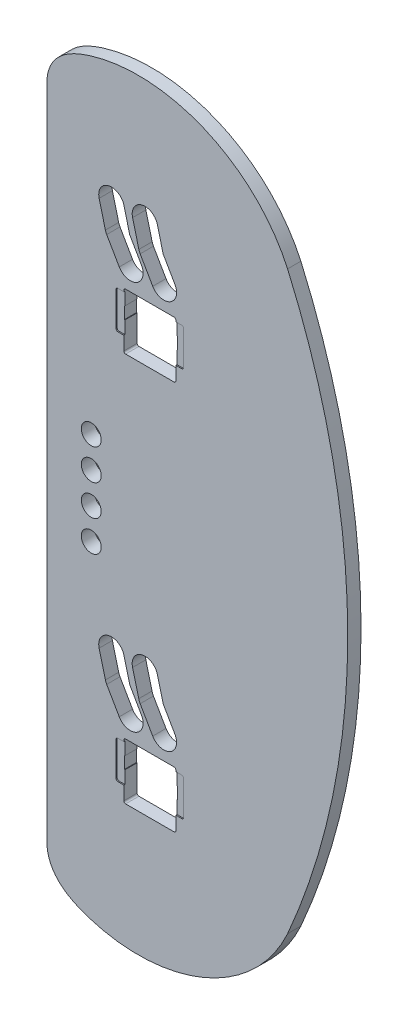
from build123d import *

# Parameters (mm, degrees)
SKETCH19_R          = 14.2875
BOSS_EXTRUDE2_DEPTH = 19.05
BOSS_EXTRUDE3_DEPTH = 17.4625


with BuildPart() as part:
    # Sketch19 → Boss-Extrude2 (new body)
    with BuildSketch(Plane.XY):
        with BuildLine():
            add(Edge.make_bspline(
                [(1361.096561672, 1948.863494174), (1364.400827848, 1984.023171072), (1498.613211066, 2056.462277252), (1658.30760281, 1990.654880293), (1706.236065024, 1885.549246122)],
                knots=[0, 0, 0, 0, 0.219674411, 1, 1, 1, 1], degree=3))
            Line((1361.096561672, 1948.863494174), (1361.096561672, 996.363494176))
            add(Edge.make_bspline(
                [(1361.096561672, 996.363494176), (1364.400827848, 961.203817278), (1498.613211066, 888.764711097), (1658.30760281, 954.572108057), (1706.236065024, 1059.677742228)],
                knots=[0, 0, 0, 0, 0.219674411, 1, 1, 1, 1], degree=3))
            ThreePointArc((1706.236065024, 1059.677742228), (1792.519416012, 1472.613494175), (1706.236065024, 1885.549246122))
        make_face()
        with BuildLine():
            Line((1545.970625126, 1126.827012828), (1545.970625126, 1107.300762828))
            ThreePointArc((1545.970625126, 1107.300762828), (1545.22667635, 1105.504711604), (1543.430625126, 1104.760762828))
            Line((1543.430625126, 1104.760762828), (1473.898125126, 1104.760762828))
            ThreePointArc((1473.898125126, 1104.760762828), (1472.102073902, 1105.504711604), (1471.358125126, 1107.300762828))
            Line((1471.358125126, 1107.300762828), (1471.358125126, 1126.827012828))
            Line((1471.358125126, 1126.827012828), (1462.785625126, 1126.827012828))
            ThreePointArc((1462.785625126, 1126.827012828), (1460.989573902, 1127.570961604), (1460.245625126, 1129.367012828))
            Line((1460.245625126, 1129.367012828), (1460.245625126, 1178.262012828))
            ThreePointArc((1460.245625126, 1178.262012828), (1460.989573902, 1180.058064052), (1462.785625126, 1180.802012828))
            Line((1462.785625126, 1180.802012828), (1471.358125126, 1180.802012828))
            Line((1471.358125126, 1180.802012828), (1471.358125126, 1182.865762828))
            ThreePointArc((1471.358125126, 1182.865762828), (1472.102073902, 1184.661814052), (1473.898125126, 1185.405762828))
            Line((1473.898125126, 1185.405762828), (1543.430625126, 1185.405762828))
            ThreePointArc((1543.430625126, 1185.405762828), (1545.22667635, 1184.661814052), (1545.970625126, 1182.865762828))
            Line((1545.970625126, 1182.865762828), (1545.970625126, 1180.802012828))
            Line((1545.970625126, 1180.802012828), (1554.543125126, 1180.802012828))
            ThreePointArc((1554.543125126, 1180.802012828), (1556.33917635, 1180.058064052), (1557.083125126, 1178.262012828))
            Line((1557.083125126, 1178.262012828), (1557.083125126, 1129.367012828))
            ThreePointArc((1557.083125126, 1129.367012828), (1556.33917635, 1127.570961604), (1554.543125126, 1126.827012828))
            Line((1554.543125126, 1126.827012828), (1545.970625126, 1126.827012828))
        make_face(mode=Mode.SUBTRACT)
        with BuildLine():
            Line((1444.893065071, 1244.244623225), (1435.893057671, 1279.244553225))
            ThreePointArc((1435.893057671, 1279.244553225), (1449.094985702, 1301.58631231), (1471.436744787, 1288.384384279))
            Line((1471.436744787, 1288.384384279), (1479.734522372, 1256.115340295))
            ThreePointArc((1479.734522372, 1256.115340295), (1479.841246759, 1255.791962976), (1479.990269115, 1255.485768066))
            Line((1479.990269115, 1255.485768066), (1495.595800102, 1228.231937145))
            ThreePointArc((1495.595800102, 1228.231937145), (1496.589194493, 1226.682766417), (1497.422422708, 1225.041884612))
            ThreePointArc((1497.422422708, 1225.041884612), (1488.994111708, 1201.213784587), (1464.764130707, 1208.40564094))
            Line((1464.764130707, 1208.40564094), (1446.764069078, 1239.655616711))
            ThreePointArc((1446.764069078, 1239.655616711), (1445.672935755, 1241.886666839), (1444.893065071, 1244.244623225))
        make_face(mode=Mode.SUBTRACT)
        with Locations((1424.596561672, 1405.938494174)):
            Circle(SKETCH19_R, mode=Mode.SUBTRACT)
        with Locations((1424.596561672, 1450.388494174)):
            Circle(SKETCH19_R, mode=Mode.SUBTRACT)
        with BuildLine():
            Line((1527.986726026, 1255.506514787), (1544.56575997, 1226.723451874))
            ThreePointArc((1544.56575997, 1226.723451874), (1537.823790218, 1201.663704337), (1512.764042681, 1208.405674089))
            Line((1512.764042681, 1208.405674089), (1494.764045881, 1239.655687936))
            ThreePointArc((1494.764045881, 1239.655687936), (1493.802589185, 1241.576837352), (1493.072252129, 1243.597189262))
            ThreePointArc((1493.072252129, 1243.597189262), (1492.894588833, 1244.238723731), (1492.740311476, 1244.886280075))
            Line((1492.740311476, 1244.886280075), (1483.894581433, 1279.238653731))
            ThreePointArc((1483.894581433, 1279.238653731), (1497.09201275, 1301.585586702), (1519.436740684, 1288.384422355))
            Line((1519.436740684, 1288.384422355), (1527.727745028, 1256.141718681))
            ThreePointArc((1527.727745028, 1256.141718681), (1527.835693423, 1255.815333734), (1527.986726026, 1255.506514787))
        make_face(mode=Mode.SUBTRACT)
        with Locations((1424.596561672, 1494.838494174)):
            Circle(SKETCH19_R, mode=Mode.SUBTRACT)
        with Locations((1424.596561672, 1539.288494174)):
            Circle(SKETCH19_R, mode=Mode.SUBTRACT)
        with BuildLine():
            Line((1462.785625126, 1739.602012828), (1471.358125126, 1739.602012828))
            Line((1471.358125126, 1739.602012828), (1471.358125126, 1741.665762828))
            ThreePointArc((1471.358125126, 1741.665762828), (1472.102073902, 1743.461814052), (1473.898125126, 1744.205762828))
            Line((1473.898125126, 1744.205762828), (1543.430625126, 1744.205762828))
            ThreePointArc((1543.430625126, 1744.205762828), (1545.22667635, 1743.461814052), (1545.970625126, 1741.665762828))
            Line((1545.970625126, 1741.665762828), (1545.970625126, 1739.602012828))
            Line((1545.970625126, 1739.602012828), (1554.543125126, 1739.602012828))
            ThreePointArc((1554.543125126, 1739.602012828), (1556.33917635, 1738.858064052), (1557.083125126, 1737.062012828))
            Line((1557.083125126, 1737.062012828), (1557.083125126, 1688.167012828))
            ThreePointArc((1557.083125126, 1688.167012828), (1556.33917635, 1686.370961604), (1554.543125126, 1685.627012828))
            Line((1554.543125126, 1685.627012828), (1545.970625126, 1685.627012828))
            Line((1545.970625126, 1685.627012828), (1545.970625126, 1666.100762828))
            ThreePointArc((1545.970625126, 1666.100762828), (1545.22667635, 1664.304711604), (1543.430625126, 1663.560762828))
            Line((1543.430625126, 1663.560762828), (1473.898125126, 1663.560762828))
            ThreePointArc((1473.898125126, 1663.560762828), (1472.102073902, 1664.304711604), (1471.358125126, 1666.100762828))
            Line((1471.358125126, 1666.100762828), (1471.358125126, 1685.627012828))
            Line((1471.358125126, 1685.627012828), (1462.785625126, 1685.627012828))
            ThreePointArc((1462.785625126, 1685.627012828), (1460.989573902, 1686.370961604), (1460.245625126, 1688.167012828))
            Line((1460.245625126, 1688.167012828), (1460.245625126, 1737.062012828))
            ThreePointArc((1460.245625126, 1737.062012828), (1460.989573902, 1738.858064052), (1462.785625126, 1739.602012828))
        make_face(mode=Mode.SUBTRACT)
        with BuildLine():
            Line((1444.893131568, 1803.044661302), (1435.893124168, 1838.044591302))
            ThreePointArc((1435.893124168, 1838.044591302), (1449.095052199, 1860.386350386), (1471.436811284, 1847.184422355))
            Line((1471.436811284, 1847.184422355), (1479.727821657, 1814.941695236))
            ThreePointArc((1479.727821657, 1814.941695236), (1479.835768961, 1814.615312965), (1479.98679977, 1814.30649635))
            Line((1479.98679977, 1814.30649635), (1496.565772911, 1785.52338757))
            ThreePointArc((1496.565772911, 1785.52338757), (1489.823779303, 1760.463721825), (1464.764105889, 1767.205686923))
            Line((1464.764105889, 1767.205686923), (1446.764116481, 1798.455687936))
            ThreePointArc((1446.764116481, 1798.455687936), (1445.672995031, 1800.686722627), (1444.893131568, 1803.044661302))
        make_face(mode=Mode.SUBTRACT)
        with BuildLine():
            Line((1492.893060968, 1803.044661302), (1483.893053568, 1838.044591302))
            ThreePointArc((1483.893053568, 1838.044591302), (1497.094981599, 1860.386350386), (1519.436740684, 1847.184422355))
            Line((1519.436740684, 1847.184422355), (1527.727745028, 1814.941718681))
            ThreePointArc((1527.727745028, 1814.941718681), (1527.835693423, 1814.615333734), (1527.986726026, 1814.306514787))
            Line((1527.986726026, 1814.306514787), (1544.56575257, 1785.523464721))
            ThreePointArc((1544.56575257, 1785.523464721), (1537.823782818, 1760.463717184), (1512.764035281, 1767.205686936))
            Line((1512.764035281, 1767.205686936), (1494.764045881, 1798.455687936))
            ThreePointArc((1494.764045881, 1798.455687936), (1493.672924431, 1800.686722627), (1492.893060968, 1803.044661302))
        make_face(mode=Mode.SUBTRACT)
    extrude(amount=BOSS_EXTRUDE2_DEPTH)

    # Sketch20 → Boss-Extrude3 (add)
    with BuildSketch(Plane.XY):
        with BuildLine():
            Line((1545.970625126, 1145.083262828), (1545.970625126, 1126.827012828))
            Line((1545.970625126, 1126.827012828), (1554.543125126, 1126.827012828))
            ThreePointArc((1554.543125126, 1126.827012828), (1556.33917635, 1127.570961604), (1557.083125126, 1129.367012828))
            Line((1557.083125126, 1129.367012828), (1557.083125126, 1178.262012828))
            ThreePointArc((1557.083125126, 1178.262012828), (1556.33917635, 1180.058064052), (1554.543125126, 1180.802012828))
            Line((1554.543125126, 1180.802012828), (1545.970625126, 1180.802012828))
            Line((1545.970625126, 1180.802012828), (1545.970625126, 1162.545762828))
            Line((1545.970625126, 1162.545762828), (1546.764375126, 1162.545762828))
            Line((1546.764375126, 1162.545762828), (1546.764375126, 1145.083262828))
            Line((1546.764375126, 1145.083262828), (1545.970625126, 1145.083262828))
        make_face()
        with BuildLine():
            Line((1462.785625126, 1126.827012828), (1471.358125126, 1126.827012828))
            Line((1471.358125126, 1126.827012828), (1471.358125126, 1145.083262828))
            Line((1471.358125126, 1145.083262828), (1470.564375126, 1145.083262828))
            Line((1470.564375126, 1145.083262828), (1470.564375126, 1162.545762828))
            Line((1470.564375126, 1162.545762828), (1471.358125126, 1162.545762828))
            Line((1471.358125126, 1162.545762828), (1471.358125126, 1180.802012828))
            Line((1471.358125126, 1180.802012828), (1462.785625126, 1180.802012828))
            ThreePointArc((1462.785625126, 1180.802012828), (1460.989573902, 1180.058064052), (1460.245625126, 1178.262012828))
            Line((1460.245625126, 1178.262012828), (1460.245625126, 1129.367012828))
            ThreePointArc((1460.245625126, 1129.367012828), (1460.989573902, 1127.570961604), (1462.785625126, 1126.827012828))
        make_face()
        with BuildLine():
            Line((1470.564375126, 1703.883262828), (1470.564375126, 1721.345762828))
            Line((1470.564375126, 1721.345762828), (1471.358125126, 1721.345762828))
            Line((1471.358125126, 1721.345762828), (1471.358125126, 1739.602012828))
            Line((1471.358125126, 1739.602012828), (1462.785625126, 1739.602012828))
            ThreePointArc((1462.785625126, 1739.602012828), (1460.989573902, 1738.858064052), (1460.245625126, 1737.062012828))
            Line((1460.245625126, 1737.062012828), (1460.245625126, 1688.167012828))
            ThreePointArc((1460.245625126, 1688.167012828), (1460.989573902, 1686.370961604), (1462.785625126, 1685.627012828))
            Line((1462.785625126, 1685.627012828), (1471.358125126, 1685.627012828))
            Line((1471.358125126, 1685.627012828), (1471.358125126, 1703.883262828))
            Line((1471.358125126, 1703.883262828), (1470.564375126, 1703.883262828))
        make_face()
        with BuildLine():
            Line((1554.543125126, 1739.602012828), (1545.970625126, 1739.602012828))
            Line((1545.970625126, 1739.602012828), (1545.970625126, 1721.345762828))
            Line((1545.970625126, 1721.345762828), (1546.764375126, 1721.345762828))
            Line((1546.764375126, 1721.345762828), (1546.764375126, 1703.883262828))
            Line((1546.764375126, 1703.883262828), (1545.970625126, 1703.883262828))
            Line((1545.970625126, 1703.883262828), (1545.970625126, 1685.627012828))
            Line((1545.970625126, 1685.627012828), (1554.543125126, 1685.627012828))
            ThreePointArc((1554.543125126, 1685.627012828), (1556.33917635, 1686.370961604), (1557.083125126, 1688.167012828))
            Line((1557.083125126, 1688.167012828), (1557.083125126, 1737.062012828))
            ThreePointArc((1557.083125126, 1737.062012828), (1556.33917635, 1738.858064052), (1554.543125126, 1739.602012828))
        make_face()
    extrude(amount=BOSS_EXTRUDE3_DEPTH)


solid = part.part
